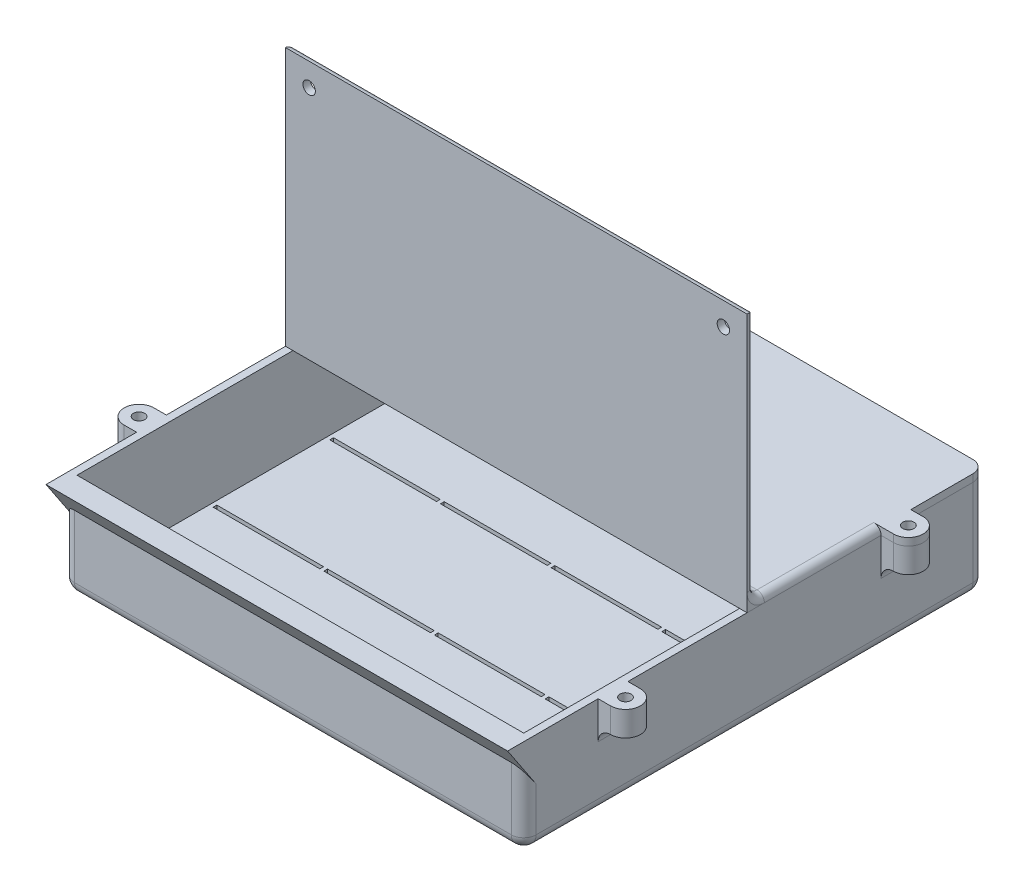
from build123d import *
from OCP.BRepFilletAPI import BRepFilletAPI_MakeFillet

# Parameters (mm, degrees)
SKETCH2_W                = 180
SKETCH2_H                = 180
SKETCH2_W_2              = 43
SKETCH2_H_2              = 1.5
BOSS_EXTRUDE1_DEPTH      = 3
SKETCH2_5_W              = 43
SKETCH2_5_H              = 1.5
BOSS_EXTRUDE2_DEPTH      = 1.5
SKETCH3_W                = 186
SKETCH3_H                = 186
SKETCH3_W_2              = 180
SKETCH3_H_2              = 180
BOSS_EXTRUDE3_DEPTH      = 40
BOSS_EXTRUDE5_DEPTH      = 93
BOSS_EXTRUDE5_DEPTH_BACK = 93
BOSS_EXTRUDE6_DEPTH      = 93
BOSS_EXTRUDE6_DEPTH_BACK = 93
FILLET1_R                = 5
FILLET3_R1               = 5
FILLET3_R2               = 4
SKETCH7_R                = 2.5
CUT_EXTRUDE1_DEPTH       = 3
SKETCH8_R                = 2.25
BOSS_EXTRUDE7_DEPTH      = 3
SKETCH9_R                = 2.25
BOSS_EXTRUDE8_DEPTH      = 10
FILLET4_R                = 5
FILLET5_R                = 3


# Some blends are built 0.0001 mm under size
with BuildPart() as part:
    # Sketch2 → Boss-Extrude1 (new body)
    with BuildSketch(Plane(origin=(0, 0, 0), x_dir=(1, 0, 0), z_dir=(0, 1, 0))):
        Rectangle(SKETCH2_W, SKETCH2_H)
        with Locations((-66.9, 11)):
            Rectangle(SKETCH2_W_2, SKETCH2_H_2, mode=Mode.SUBTRACT)
        with Locations((-22.3, 11)):
            Rectangle(SKETCH2_W_2, SKETCH2_H_2, mode=Mode.SUBTRACT)
        with Locations((66.9, 11)):
            Rectangle(SKETCH2_W_2, SKETCH2_H_2, mode=Mode.SUBTRACT)
        with Locations((22.3, 11)):
            Rectangle(SKETCH2_W_2, SKETCH2_H_2, mode=Mode.SUBTRACT)
        with Locations((66.9, -36)):
            Rectangle(SKETCH2_W_2, SKETCH2_H_2, mode=Mode.SUBTRACT)
        with Locations((22.3, -36)):
            Rectangle(SKETCH2_W_2, SKETCH2_H_2, mode=Mode.SUBTRACT)
        with Locations((-22.3, -36)):
            Rectangle(SKETCH2_W_2, SKETCH2_H_2, mode=Mode.SUBTRACT)
        with Locations((-66.9, -36)):
            Rectangle(SKETCH2_W_2, SKETCH2_H_2, mode=Mode.SUBTRACT)
    extrude(amount=BOSS_EXTRUDE1_DEPTH)

    # Sketch2<5> → Boss-Extrude2 (add)
    with BuildSketch(Plane(origin=(0, 0, 0), x_dir=(1, 0, 0), z_dir=(0, 1, 0))):
        with Locations((22.3, 11)):
            Rectangle(SKETCH2_5_W, SKETCH2_5_H)
        with Locations((66.9, 11)):
            Rectangle(SKETCH2_5_W, SKETCH2_5_H)
        with Locations((-66.9, -36)):
            Rectangle(SKETCH2_5_W, SKETCH2_5_H)
        with Locations((-22.3, -36)):
            Rectangle(SKETCH2_5_W, SKETCH2_5_H)
        with Locations((66.9, -36)):
            Rectangle(SKETCH2_5_W, SKETCH2_5_H)
        with Locations((22.3, -36)):
            Rectangle(SKETCH2_5_W, SKETCH2_5_H)
        with Locations((-66.9, 11)):
            Rectangle(SKETCH2_5_W, SKETCH2_5_H)
        with Locations((-22.3, 11)):
            Rectangle(SKETCH2_5_W, SKETCH2_5_H)
    extrude(amount=BOSS_EXTRUDE2_DEPTH)

    # Sketch3 → Boss-Extrude3 (add)
    with BuildSketch(Plane(origin=(0, 0, 0), x_dir=(1, 0, 0), z_dir=(0, 1, 0))):
        Rectangle(SKETCH3_W, SKETCH3_H)
        Rectangle(SKETCH3_W_2, SKETCH3_H_2, mode=Mode.SUBTRACT)
    extrude(amount=BOSS_EXTRUDE3_DEPTH)

    # Sketch5 → Boss-Extrude5 (add, two sides: drawn at the far end of the back side and taken through both)
    with BuildSketch(Plane(origin=(0, 0, 0), x_dir=(0, 0, -1), z_dir=(1, 0, 0)).offset(-BOSS_EXTRUDE5_DEPTH_BACK)):
        Polygon((-93, 40), (-99.5, 40), (-93, 30.25), align=None)
    extrude(amount=BOSS_EXTRUDE5_DEPTH + BOSS_EXTRUDE5_DEPTH_BACK)

    # Fillet1
    fillet1_edges = [part.edges().sort_by_distance(p)[0] for p in [
        (93, 0, 0),
        (0, 0, -93),
        (93, 20, -93),
        (-93, 0, 0),
        (-93, 20, -93),
        (0, 0, 93),
        (93, 15.125, 93),
        (-93, 15.125, 93),
    ]]
    fillet(fillet1_edges, radius=FILLET1_R)

    # Sketch9 → Boss-Extrude8 (add)
    # profile 1 of 4: a face of its own
    with BuildSketch(Plane(origin=(0, 40, 0), x_dir=(1, 0, 0), z_dir=(0, 1, 0))):
        with BuildLine():
            Line((93, 51), (98, 51))
            ThreePointArc((98, 51), (104, 57), (98, 63))
            Line((98, 63), (93, 63))
            Line((93, 63), (93, 51))
        make_face()
        with Locations(Location((98, 57, 0), (0, 0, 270))):
            Circle(SKETCH9_R, mode=Mode.SUBTRACT)
    # profile 2 of 4: a face of its own
    with BuildSketch(Plane(origin=(0, 40, 0), x_dir=(1, 0, 0), z_dir=(0, 1, 0))):
        with BuildLine():
            Line((-98, 51), (-93, 51))
            Line((-93, 51), (-93, 63))
            Line((-93, 63), (-98, 63))
            ThreePointArc((-98, 63), (-104, 57), (-98, 51))
        make_face()
        with Locations(Location((-98, 57, 0), (0, 0, 90))):
            Circle(SKETCH9_R, mode=Mode.SUBTRACT)
    # profile 3 of 4: a face of its own
    with BuildSketch(Plane(origin=(0, 40, 0), x_dir=(1, 0, 0), z_dir=(0, 1, 0))):
        with BuildLine():
            Line((93, -51), (93, -63))
            Line((93, -63), (98, -63))
            ThreePointArc((98, -63), (104, -57), (98, -51))
            Line((98, -51), (93, -51))
        make_face()
        with Locations(Location((98, -57, 0), (0, 0, 90))):
            Circle(SKETCH9_R, mode=Mode.SUBTRACT)
    # profile 4 of 4: a face of its own
    with BuildSketch(Plane(origin=(0, 40, 0), x_dir=(1, 0, 0), z_dir=(0, 1, 0))):
        with BuildLine():
            Line((-93, -51), (-93, -63))
            Line((-93, -63), (-98, -63))
            ThreePointArc((-98, -63), (-104, -57), (-98, -51))
            Line((-98, -51), (-93, -51))
        make_face()
        with Locations(Location((-98, -57, 0), (0, 0, 90))):
            Circle(SKETCH9_R, mode=Mode.SUBTRACT)
    extrude(amount=-BOSS_EXTRUDE8_DEPTH)

    # Fillet4
    # the kernel refuses this fillet: 5 mm, written as the material it adds along each edge
    with BuildSketch(Plane(origin=(93, 30, -63), x_dir=(0, -1, 0), z_dir=(0, 0, 1))) as fillet4_piece_1_section:
        with BuildLine():
            CenterArc((FILLET4_R, FILLET4_R), FILLET4_R, 180, 90)
            Line((0, FILLET4_R), (0, 0))
            Line((0, 0), (FILLET4_R, 0))
        make_face()
    fillet4_piece_1 = extrude(amount=12, mode=Mode.PRIVATE)
    fillet4_piece_1 = fillet4_piece_1 - Plane(origin=(98, 28.528949062, -57), x_dir=(0, 0, 1), z_dir=(0, 1, 0)) * Cylinder(2.25, 44, mode=Mode.PRIVATE)
    add(fillet4_piece_1)
    with BuildSketch(Plane(origin=(93, 30, 51), x_dir=(0, -1, 0), z_dir=(0, 0, 1))) as fillet4_piece_2_section:
        with BuildLine():
            CenterArc((FILLET4_R, FILLET4_R), FILLET4_R, 180, 90)
            Line((0, FILLET4_R), (0, 0))
            Line((0, 0), (FILLET4_R, 0))
        make_face()
    fillet4_piece_2 = extrude(amount=12, mode=Mode.PRIVATE)
    fillet4_piece_2 = fillet4_piece_2 - Plane(origin=(98, 28.528949062, 57), x_dir=(0, 0, -1), z_dir=(0, 1, 0)) * Cylinder(2.25, 44, mode=Mode.PRIVATE)
    add(fillet4_piece_2)
    with BuildSketch(Plane(origin=(-93, 30, -51), x_dir=(0, -1, 0), z_dir=(0, 0, -1))) as fillet4_piece_3_section:
        with BuildLine():
            CenterArc((FILLET4_R, FILLET4_R), FILLET4_R, 180, 90)
            Line((0, FILLET4_R), (0, 0))
            Line((0, 0), (FILLET4_R, 0))
        make_face()
    fillet4_piece_3 = extrude(amount=12, mode=Mode.PRIVATE)
    fillet4_piece_3 = fillet4_piece_3 - Plane(origin=(-98, 28.528949062, -57), x_dir=(0, 0, -1), z_dir=(0, 1, 0)) * Cylinder(2.25, 44, mode=Mode.PRIVATE)
    add(fillet4_piece_3)
    with BuildSketch(Plane(origin=(-93, 30, 51), x_dir=(0, -1, 0), z_dir=(0, 0, 1))) as fillet4_piece_4_section:
        with BuildLine():
            CenterArc((FILLET4_R, -FILLET4_R), FILLET4_R, 90, 90)
            Line((0, -FILLET4_R), (0, 0))
            Line((0, 0), (FILLET4_R, 0))
        make_face()
    fillet4_piece_4 = extrude(amount=12, mode=Mode.PRIVATE)
    fillet4_piece_4 = fillet4_piece_4 - Plane(origin=(-98, 28.528949062, 57), x_dir=(0, 0, -1), z_dir=(0, 1, 0)) * Cylinder(2.25, 44, mode=Mode.PRIVATE)
    add(fillet4_piece_4)


with BuildPart() as body_2:
    # Sketch6 → Boss-Extrude6 (new, two sides: drawn at the far end of the back side and taken through both)
    with BuildSketch(Plane(origin=(0, 0, 0), x_dir=(0, 0, -1), z_dir=(1, 0, 0)).offset(-BOSS_EXTRUDE6_DEPTH_BACK)):
        Polygon((93, 40), (-3, 40), (-3, 144.24), (0, 144.24), (0, 43), (93, 43), align=None)
    extrude(amount=BOSS_EXTRUDE6_DEPTH + BOSS_EXTRUDE6_DEPTH_BACK)

    # Fillet3: one fillet with a radius per group of edges: ONE call of the kernel's fillet builder (fillet() takes one radius for all edges)
    fillet3_edges_1 = [body_2.edges().sort_by_distance(p)[0] for p in [
        (93, 41.5, -93),
        (-93, 41.5, -93),
    ]]
    fillet3_edges_2 = [body_2.edges().sort_by_distance(p)[0] for p in [
        (0, 43, 0),
    ]]
    fillet3 = BRepFilletAPI_MakeFillet(body_2.part.solid().wrapped)
    for e in fillet3_edges_1:
        fillet3.Add(FILLET3_R1, e.wrapped)
    for e in fillet3_edges_2:
        fillet3.Add(FILLET3_R2, e.wrapped)
    add(Compound.cast(fillet3.Shape()), mode=Mode.REPLACE)

    # Sketch7 → Cut-Extrude1 (cut)
    with BuildSketch(Plane.XY.offset(3)):
        with Locations((83.459521349, 134.98252756)):
            Circle(SKETCH7_R)
        with Locations((-83.459521349, 134.98252756)):
            Circle(SKETCH7_R)
    extrude(amount=-CUT_EXTRUDE1_DEPTH, mode=Mode.SUBTRACT)

    # Sketch8 → Boss-Extrude7 (add)
    # profile 1 of 2: a face of its own
    with BuildSketch(Plane(origin=(0, 43, 0), x_dir=(1, 0, 0), z_dir=(0, 1, 0))):
        with BuildLine():
            Line((93, 63), (98, 63))
            ThreePointArc((98, 63), (104, 57), (98, 51))
            Line((98, 51), (93, 51))
            Line((93, 51), (93, 63))
        make_face()
        with Locations(Location((98, 57, 0), (0, 0, 270))):
            Circle(SKETCH8_R, mode=Mode.SUBTRACT)
    # profile 2 of 2: a face of its own
    with BuildSketch(Plane(origin=(0, 43, 0), x_dir=(1, 0, 0), z_dir=(0, 1, 0))):
        with BuildLine():
            Line((-93, 63), (-93, 51))
            Line((-93, 51), (-98, 51))
            ThreePointArc((-98, 51), (-104, 57), (-98, 63))
            Line((-98, 63), (-93, 63))
        make_face()
        with Locations(Location((-98, 57, 0), (0, 0, 90))):
            Circle(SKETCH8_R, mode=Mode.SUBTRACT)
    extrude(amount=-BOSS_EXTRUDE7_DEPTH)

    # Fillet5
    fillet5_edges = [body_2.edges().sort_by_distance(p)[0] for p in [
        (93, 43, -27.5),
        (93, 44.171572875, -1.171572875),
        (-93, 43, -27.5),
        (-93, 44.171572875, -1.171572875),
        (93, 95.62, 0),
        (0, 144.24, 0),
        (-93, 95.62, 0),
    ]]
    fillet(fillet5_edges, radius=FILLET5_R - 0.0001)  # a hair under: the kernel refuses the full size


solid = Compound([part.part, body_2.part])
